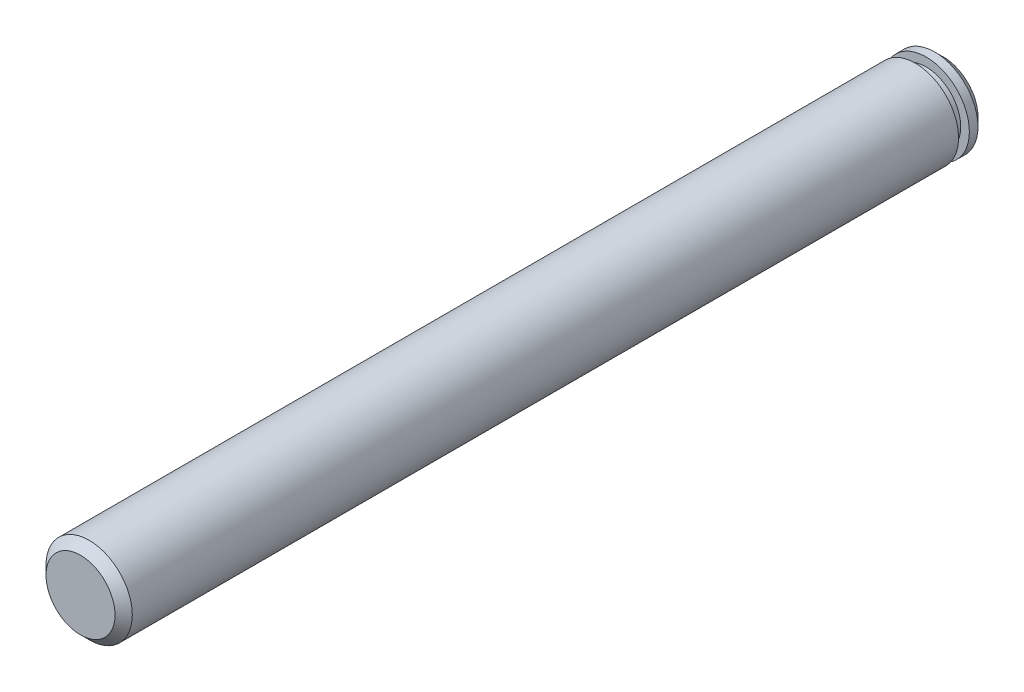
from build123d import *

# Parameters (mm, degrees)
SKETCH1_R           = 6.35
BOSS_EXTRUDE1_DEPTH = 127
CHAMFER1_SIZE       = 1.27
SKETCH2_W           = 6.845314317
SKETCH2_H           = 1.5875


with BuildPart() as part:
    # Sketch1 → Boss-Extrude1 (new body)
    with BuildSketch(Plane.XY):
        Circle(SKETCH1_R)
    extrude(amount=BOSS_EXTRUDE1_DEPTH)

    # Chamfer1
    chamfer1_edges = [part.edges().sort_by_distance(p)[0] for p in [
        (-6.35, 0, 0),
        (-6.35, 0, 127),
    ]]
    chamfer(chamfer1_edges, length=CHAMFER1_SIZE)

    # Sketch2 → Cut-Revolve1 (revolve, cut)
    with BuildSketch(Plane(origin=(0, 0, 0), x_dir=(1, 0, 0), z_dir=(0, 1, 0))):
        with Locations((8.502657158, -3.33375)):
            Rectangle(SKETCH2_W, SKETCH2_H)
    revolve(axis=Axis((0, 0, 0), (0, 0, 1)), mode=Mode.SUBTRACT)


solid = part.part
